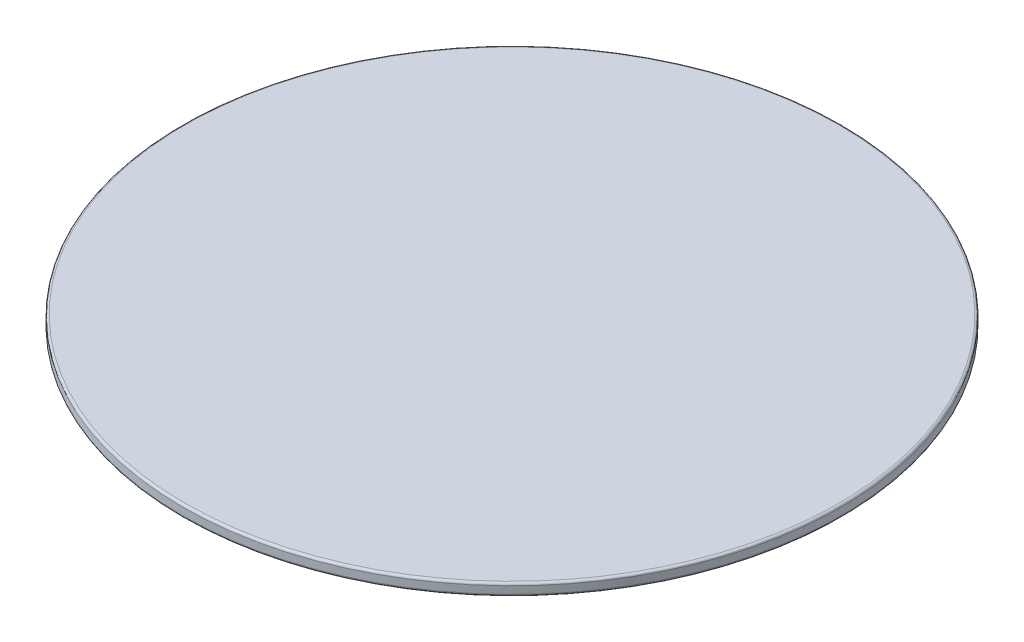
from build123d import *

# Parameters (mm, degrees)
SKETCH1_R           = 145
BOSS_EXTRUDE1_DEPTH = 5.25
FILLET1_R           = 1


with BuildPart() as part:
    # Sketch1 → Boss-Extrude1 (new body)
    with BuildSketch(Plane(origin=(0, 0, 0), x_dir=(1, 0, 0), z_dir=(0, 1, 0))):
        Circle(SKETCH1_R)
    extrude(amount=BOSS_EXTRUDE1_DEPTH)

    # Fillet1
    fillet1_edges = [part.edges().sort_by_distance(p)[0] for p in [
        (-145, 5.25, 0),
        (-145, 0, 0),
    ]]
    fillet(fillet1_edges, radius=FILLET1_R)


solid = part.part
